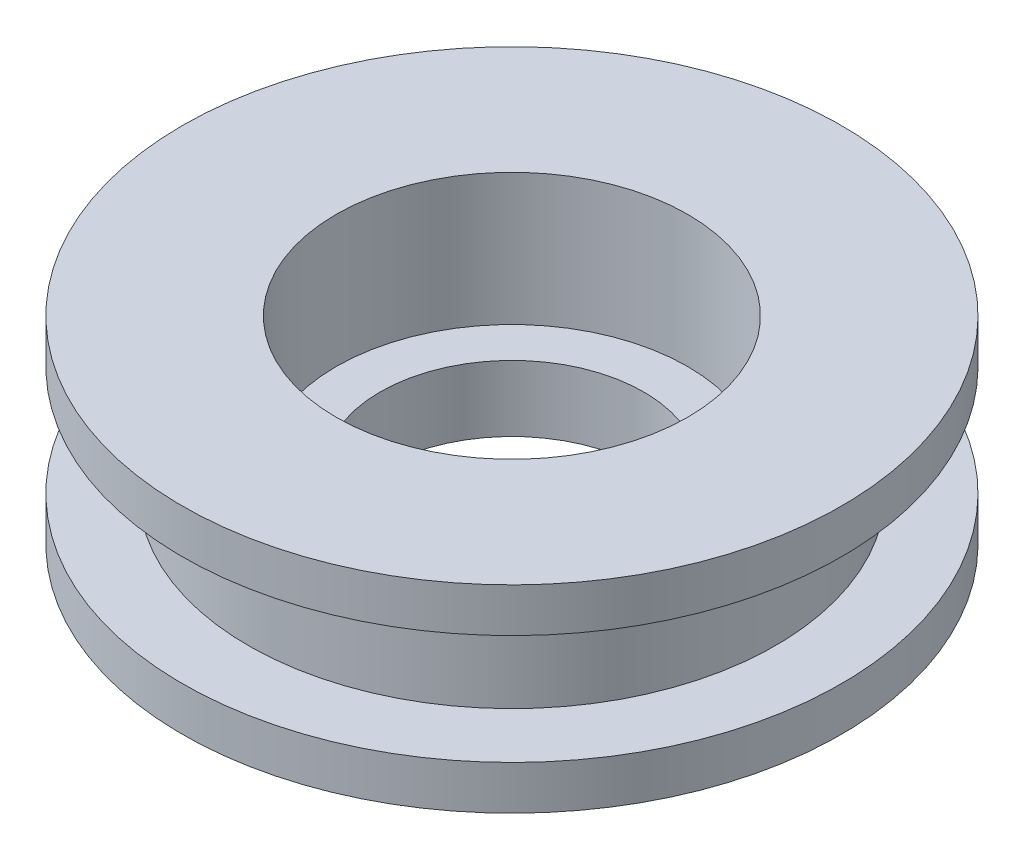
from build123d import *


with BuildPart() as part:
    # Sketch1 → Revolve1 (revolve)
    with BuildSketch(Plane.XY):
        Polygon((4, 2.25), (4, -0.75), (3, -0.75), (3, -2.25), (7.5, -2.25), (7.5, -1.25), (6, -1.25), (6, 1.25), (7.5, 1.25), (7.5, 2.25), align=None)
    revolve(axis=Axis((0, 6.620558795, 0), (0, -1, 0)))


solid = part.part
